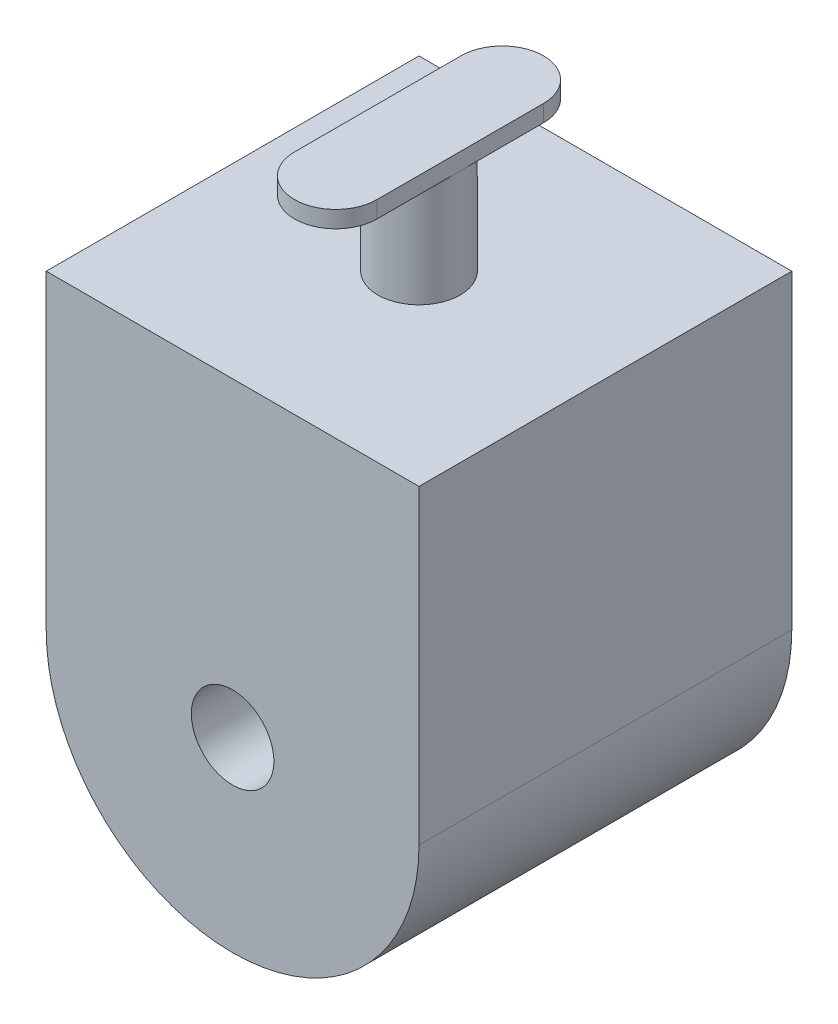
from build123d import *

# Parameters (mm, degrees)
BOSS_EXTRUDE1_DEPTH = 38.1
SKETCH2_R           = 4.2164
CUT_EXTRUDE1_DEPTH  = 38.1
SKETCH3_R           = 4.2164
BOSS_EXTRUDE2_DEPTH = 12.7
BOSS_EXTRUDE3_DEPTH = 1.7145


with BuildPart() as part:
    # Sketch1 → Boss-Extrude1 (new body)
    with BuildSketch(Plane.XY):
        with BuildLine():
            Line((-19.05, -15.875), (-19.05, 15.875))
            Line((-19.05, 15.875), (19.05, 15.875))
            Line((19.05, 15.875), (19.05, -15.875))
            ThreePointArc((19.05, -15.875), (0, -34.925), (-19.05, -15.875))
        make_face()
    extrude(amount=BOSS_EXTRUDE1_DEPTH)

    # Sketch2 → Cut-Extrude1 (cut)
    with BuildSketch(Plane(origin=(0, 0, 0), x_dir=(-1, 0, 0), z_dir=(0, 0, -1))):
        with Locations((0, -15.875)):
            Circle(SKETCH2_R)
    extrude(amount=-CUT_EXTRUDE1_DEPTH, mode=Mode.SUBTRACT)

    # Sketch3 → Boss-Extrude2 (add)
    with BuildSketch(Plane(origin=(0, 15.875, 0), x_dir=(1, 0, 0), z_dir=(0, 1, 0))):
        with Locations((0, -19.05)):
            Circle(SKETCH3_R)
    extrude(amount=BOSS_EXTRUDE2_DEPTH)

    # Sketch4 → Boss-Extrude3 (add)
    with BuildSketch(Plane(origin=(0, 28.575, 0), x_dir=(1, 0, 0), z_dir=(0, 1, 0))):
        with BuildLine():
            Line((-4.2164, -27.559), (-4.2164, -10.541))
            ThreePointArc((-4.2164, -10.541), (0, -6.3246), (4.2164, -10.541))
            Line((4.2164, -10.541), (4.2164, -27.559))
            ThreePointArc((4.2164, -27.559), (0, -31.7754), (-4.2164, -27.559))
        make_face()
    extrude(amount=-BOSS_EXTRUDE3_DEPTH)


solid = part.part
